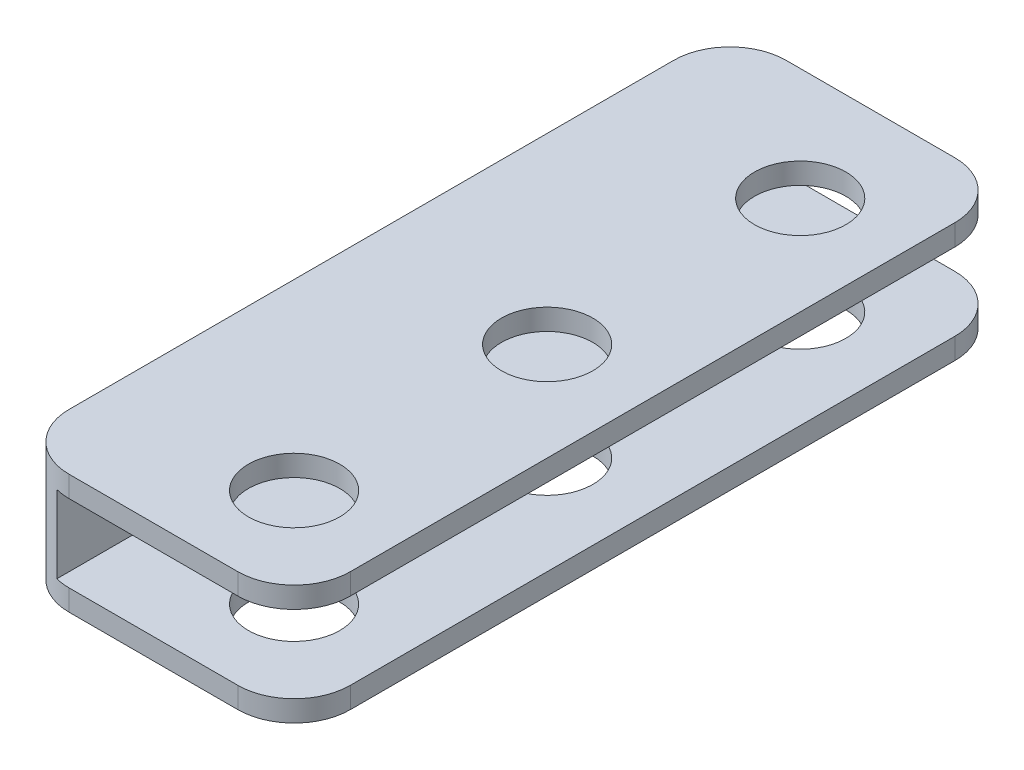
from build123d import *

# Parameters (mm, degrees)
SKETCH1_W           = 20
SKETCH1_H           = 51
BOSS_EXTRUDE1_DEPTH = 1.5
SKETCH2_W           = 3
SKETCH2_H           = 51
BOSS_EXTRUDE2_DEPTH = 5.5
SKETCH3_W           = 20
SKETCH3_H           = 51
BOSS_EXTRUDE3_DEPTH = 1.5
SKETCH4_R           = 3.25
CUT_EXTRUDE1_DEPTH  = 15
FILLET1_R           = 4


with BuildPart() as part:
    # Sketch1 → Boss-Extrude1 (new body)
    with BuildSketch(Plane(origin=(0, 0, 0), x_dir=(1, 0, 0), z_dir=(0, 1, 0))):
        Rectangle(SKETCH1_W, SKETCH1_H)
    extrude(amount=BOSS_EXTRUDE1_DEPTH)

    # Sketch2 → Boss-Extrude2 (add)
    with BuildSketch(Plane(origin=(0, 1.5, 0), x_dir=(1, 0, 0), z_dir=(0, 1, 0))):
        with Locations((-8.5, 0)):
            Rectangle(SKETCH2_W, SKETCH2_H)
    extrude(amount=BOSS_EXTRUDE2_DEPTH)

    # Sketch3 → Boss-Extrude3 (add)
    with BuildSketch(Plane(origin=(0, 7, 0), x_dir=(1, 0, 0), z_dir=(0, 1, 0))):
        Rectangle(SKETCH3_W, SKETCH3_H)
    extrude(amount=BOSS_EXTRUDE3_DEPTH)

    # Sketch4 → Cut-Extrude1 (cut)
    with BuildSketch(Plane(origin=(0, 8.5, 0), x_dir=(1, 0, 0), z_dir=(0, 1, 0))):
        with Locations(Location((3, 17.5, 0), (0, 0, 270))):
            Circle(SKETCH4_R)
        with Locations(Location((3, -0.5, 0), (0, 0, 270))):
            Circle(SKETCH4_R)
        with Locations(Location((3, -18.5, 0), (0, 0, 270))):
            Circle(SKETCH4_R)
    extrude(amount=-CUT_EXTRUDE1_DEPTH, mode=Mode.SUBTRACT)

    # Fillet1
    # the kernel refuses this fillet: 4 mm, written as the material it takes off along each edge
    with BuildSketch(Plane(origin=(-10, 18.5, 25.5), x_dir=(1, 0, 0), z_dir=(0, -1, 0)), Plane(origin=(-10, 18.5, -25.5), x_dir=(0, 0, 1), z_dir=(0, -1, 0))) as fillet1_piece_1:
        with BuildLine():
            CenterArc((FILLET1_R, -FILLET1_R), FILLET1_R, 90, 90)
            Line((0, -FILLET1_R), (0, 0))
            Line((0, 0), (FILLET1_R, 0))
        make_face()
    extrude(amount=28.5, mode=Mode.SUBTRACT)
    with BuildSketch(Plane(origin=(10, -10, 25.5), x_dir=(-1, 0, 0), z_dir=(0, 1, 0)), Plane(origin=(10, -3, 25.5), x_dir=(-1, 0, 0), z_dir=(0, 1, 0)), Plane(origin=(10, -10, -25.5), x_dir=(0, 0, 1), z_dir=(0, 1, 0)), Plane(origin=(10, -3, -25.5), x_dir=(0, 0, 1), z_dir=(0, 1, 0))) as fillet1_piece_2:
        with BuildLine():
            CenterArc((FILLET1_R, -FILLET1_R), FILLET1_R, 90, 90)
            Line((0, -FILLET1_R), (0, 0))
            Line((0, 0), (FILLET1_R, 0))
        make_face()
    extrude(amount=21.5, mode=Mode.SUBTRACT)


solid = part.part
